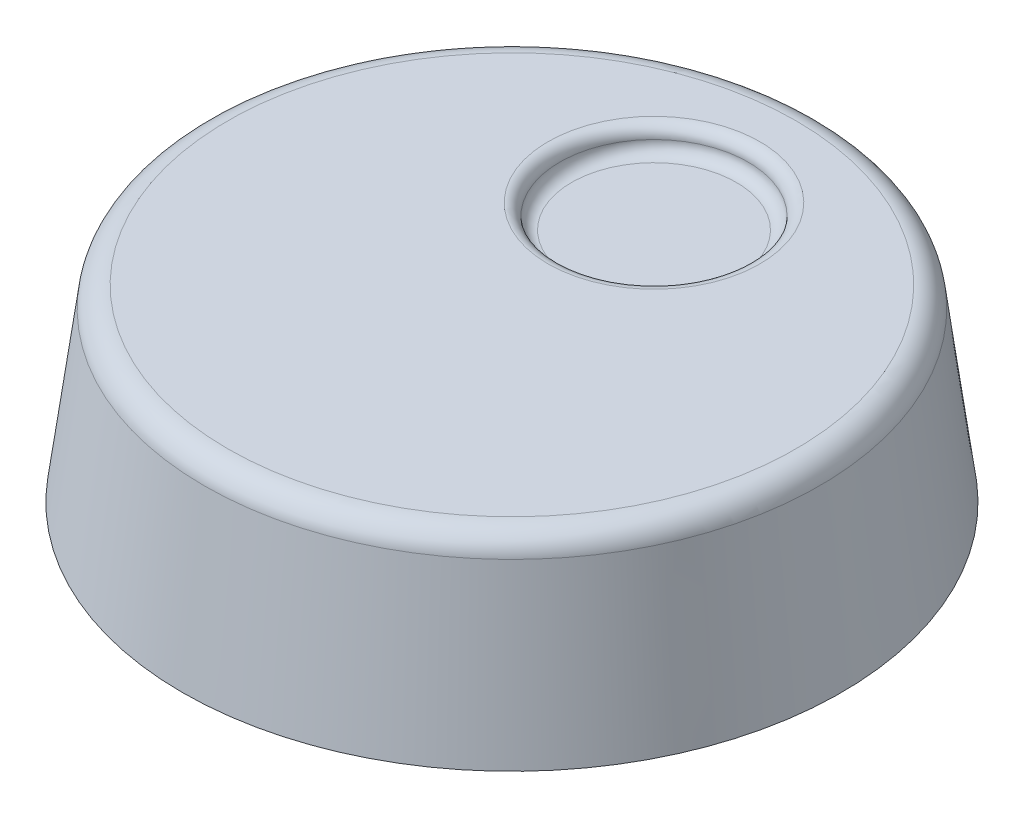
from build123d import *

# Parameters (mm, degrees)
SKETCH1_R           = 22.225
BOSS_EXTRUDE1_DEPTH = 12.7
BOSS_EXTRUDE1_TAPER = 7.5
FILLET1_R           = 1.5875
SKETCH2_R           = 6.35
CUT_EXTRUDE1_DEPTH  = 1.5875
FILLET2_R           = 0.79375
CUT_EXTRUDE2_DEPTH  = 9.525
SKETCH4_R           = 3.175
CUT_EXTRUDE3_DEPTH  = 2.54


with BuildPart() as part:
    # Sketch1 → Boss-Extrude1 (new body)
    with BuildSketch(Plane(origin=(0, 0, 0), x_dir=(1, 0, 0), z_dir=(0, 1, 0))):
        Circle(SKETCH1_R)
    extrude(amount=BOSS_EXTRUDE1_DEPTH, taper=BOSS_EXTRUDE1_TAPER)

    # Fillet1
    fillet1_edges = [part.edges().sort_by_distance(p)[0] for p in [
        (-20.553013281, 12.7, 0),
    ]]
    fillet(fillet1_edges, radius=FILLET1_R)

    # Sketch2 → Cut-Extrude1 (cut)
    with BuildSketch(Plane(origin=(0, 12.7, 0), x_dir=(1, 0, 0), z_dir=(0, 1, 0))):
        with Locations(Location((0, 9.580406573, 0), (0, 0, 270))):
            Circle(SKETCH2_R)
    extrude(amount=-CUT_EXTRUDE1_DEPTH, mode=Mode.SUBTRACT)

    # Fillet2
    fillet2_edges = [part.edges().sort_by_distance(p)[0] for p in [
        (0, 11.1125, -15.930406573),
        (0, 12.7, -15.930406573),
    ]]
    fillet(fillet2_edges, radius=FILLET2_R - 0.0001)  # a hair under: the kernel refuses the full size

    # Sketch3 → Cut-Extrude2 (cut)
    with BuildSketch(Plane.XZ):
        with BuildLine():
            Line((-2.851142929, -1.397), (2.851142929, -1.397))
            ThreePointArc((2.851142929, -1.397), (0, 3.175), (-2.851142929, -1.397))
        make_face()
    extrude(amount=-CUT_EXTRUDE2_DEPTH, mode=Mode.SUBTRACT)

    # Sketch4 → Cut-Extrude3 (cut)
    with BuildSketch(Plane.XZ):
        with Locations(Location((0, 0, 0), (0, 0, 270))):
            Circle(SKETCH4_R)
    extrude(amount=-CUT_EXTRUDE3_DEPTH, mode=Mode.SUBTRACT)


solid = part.part
